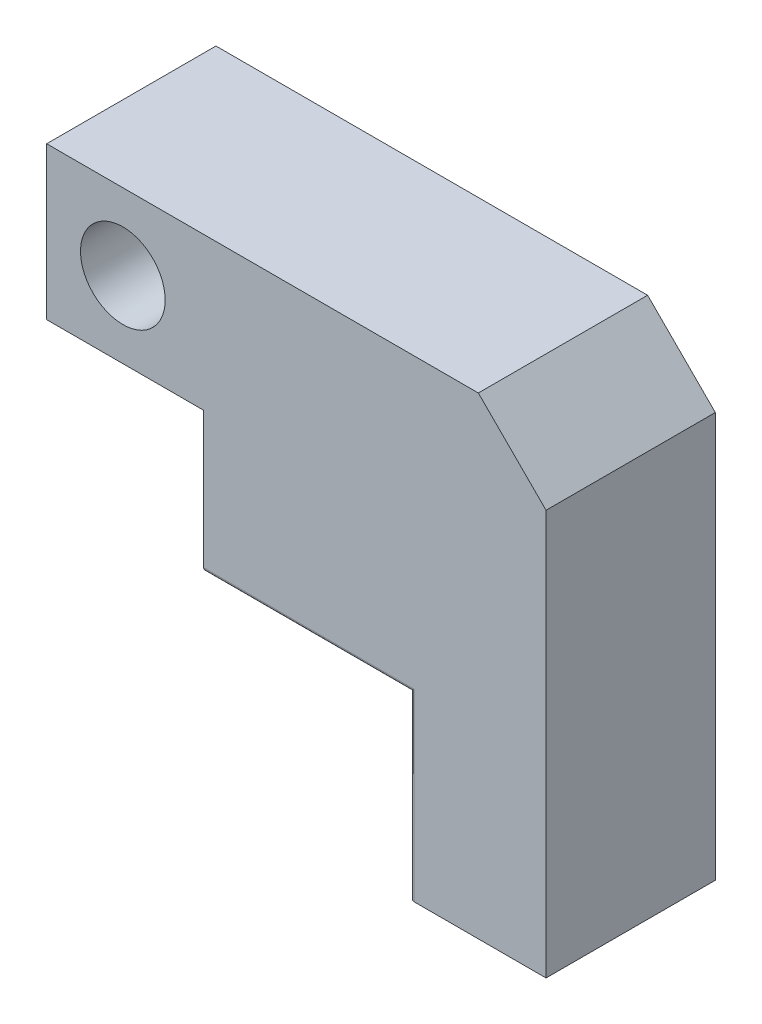
from build123d import *

# Parameters (mm, degrees)
SKETCH_1_R          = 2.5
EXTRUDE_1_DEPTH     = 10
SKETCH_2_R          = 2.5
CUT_EXTRUDE_1_DEPTH = 20
CHAMFER_1_SIZE      = 4
FILLET_1_R          = 0.2


with BuildPart() as part:
    # Эскиз1 → Вытянуть1 (new body)
    with BuildSketch(Plane.XY):
        Polygon((17.000000013, -23.429402734), (17.000000013, -12.754084516), (4.776542266, -12.754084516), (4.776542266, -4.5), (-4.5, -4.5), (-4.5, 4.5), (25.000000013, 4.5), (25.000000013, -23.429402734), align=None)
        Circle(SKETCH_1_R, mode=Mode.SUBTRACT)
    extrude(amount=EXTRUDE_1_DEPTH)

    # Эскиз2 → Вырез-Вытянуть1 (cut)
    with BuildSketch(Plane.XZ.offset(23.429402734)):
        with Locations((21.000000013, 5)):
            Circle(SKETCH_2_R)
    extrude(amount=-CUT_EXTRUDE_1_DEPTH, mode=Mode.SUBTRACT)

    # Фаска1
    chamfer_1_edges = [part.edges().sort_by_distance(p)[0] for p in [
        (25.000000013, 4.5, 5),
    ]]
    chamfer(chamfer_1_edges, length=CHAMFER_1_SIZE)

    # Скругление1
    fillet_1_edges = [part.edges().sort_by_distance(p)[0] for p in [
        (17.000000013, -18.091743625, 10),
        (17.000000013, -18.091743625, 0),
        (10.88827114, -12.754084516, 0),
        (10.88827114, -12.754084516, 10),
    ]]
    fillet(fillet_1_edges, radius=FILLET_1_R)


solid = part.part
